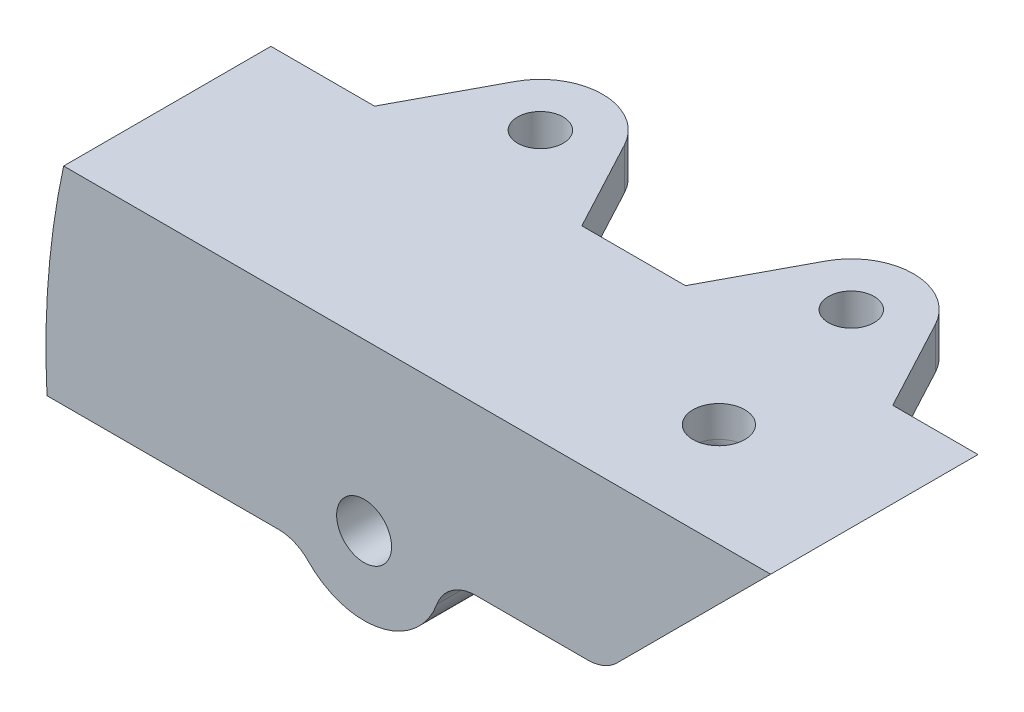
from build123d import *

# Parameters (mm, degrees)
SKETCH2_R           = 2.65
BOSS_EXTRUDE1_DEPTH = 10
SKETCH5_R           = 2.5
CHAMFER1_SIZE       = 3
FILLET4_R           = 4
SKETCH9_R           = 6
SKETCH9_R_2         = 2.2
BOSS_EXTRUDE2_DEPTH = 4
LPATTERN1_COUNT     = 2
LPATTERN1_PITCH     = 30
CHAMFER2_SIZE       = 4


with BuildPart() as part:
    # Sketch2 → Boss-Extrude1 (new, symmetric)
    with BuildSketch(Plane.XY):
        with BuildLine():
            ThreePointArc((-73.989796594, 16), (-75.457580373, 6.053392794), (-75.594245813, -4))
            Line((-75.594245813, -4), (-51.34428877, -4))
            ThreePointArc((-51.34428877, -4), (-42.918193786, -7.205281597), (-37.5, 0))
            Line((-37.5, 0), (-21.763957799, 0))
            Line((-21.763957799, 0), (-5.763957799, 16))
            Line((-5.763957799, 16), (-73.989796594, 16))
        make_face()
        with Locations((-45, 0)):
            Circle(SKETCH2_R, mode=Mode.SUBTRACT)
    extrude(amount=BOSS_EXTRUDE1_DEPTH, both=True)

    # Sketch3 → Cut-Revolve1 (revolve, cut)
    with BuildSketch(Plane.XY, mode=Mode.PRIVATE) as cut_revolve1_sk:
        Polygon((-76.457580373, 8), (-75.457580373, 8), (-50.457580373, 8), (-50.457580373, 12.2), (-70.457580373, 12.2), (-76.457580373, 12.2), align=None)
        Polygon((-76.457580373, 15.2), (-76.457580373, 12.2), (-70.457580373, 12.2), align=None)
    revolve(cut_revolve1_sk.sketch.rotate(Axis((-75.457580373, 8, 0), (1, 0, 0)), 90), axis=Axis((-75.457580373, 8, 0), (1, 0, 0)), mode=Mode.SUBTRACT)

    # Cut-Sweep2: sweep along a path in Sketch7
    with BuildLine(Plane.XY) as cut_sweep2_path:
        Line((-50.457580373, 8), (-25.763957799, 8))
        ThreePointArc((-25.763957799, 8), (-22.228423893, 9.464466094), (-20.763957799, 13))
        Line((-20.763957799, 13), (-20.763957799, 16))
    # Sketch5 → Cut-Sweep2 (sweep, cut)
    with BuildSketch(Plane(origin=(0, 16, 0), x_dir=(1, 0, 0), z_dir=(0, 1, 0))):
        with Locations((-20.763957799, 0)):
            Circle(SKETCH5_R)
    sweep(path=cut_sweep2_path.line, mode=Mode.SUBTRACT)

    # Chamfer1
    # the kernel refuses this chamfer: 3 mm, written as the material it takes off along each edge
    with BuildSketch(Plane(origin=(-50.457580373, 8, 0), x_dir=(0, -1, 0), z_dir=(0, 0, 1))) as chamfer1_piece_1_section:
        Polygon((2.5 + CHAMFER1_SIZE, 0), (2.5, CHAMFER1_SIZE), (2.5, 0), align=None)
    chamfer1_piece_1 = revolve(axis=Axis((-50.457580373, 8, 0), (1, 0, 0)), mode=Mode.PRIVATE)
    chamfer1_piece_1 = chamfer1_piece_1 & Plane(origin=(-48.295596493, 8, 0), x_dir=(0, 0, 1), z_dir=(-1, 0, 0)) * Cylinder(4.2, 22, mode=Mode.PRIVATE)
    add(chamfer1_piece_1, mode=Mode.SUBTRACT)

    # Fillet4
    fillet4_edges = [part.edges().sort_by_distance(p)[0] for p in [
        (-21.763957799, 0, 0),
        (-37.5, 0, 0),
        (-51.34428877, -4, 0),
    ]]
    fillet(fillet4_edges, radius=FILLET4_R)

    # Sketch9 → Boss-Extrude2 (add)
    # profile 1 of 3: a face of its own
    with BuildSketch(Plane(origin=(0, 16, 0), x_dir=(1, 0, 0), z_dir=(0, 1, 0))):
        with Locations((-53.989796594, 16)):
            Circle(SKETCH9_R)
        with Locations(Location((-53.989796594, 16, 0), (0, 0, 270))):
            Circle(SKETCH9_R_2, mode=Mode.SUBTRACT)
    # profile 2 of 3: a face of its own
    with BuildSketch(Plane(origin=(0, 16, 0), x_dir=(1, 0, 0), z_dir=(0, 1, 0))):
        with BuildLine():
            ThreePointArc((-47.989796594, 16), (-49.747155907, 11.757359313), (-53.989796594, 10))
            Line((-53.989796594, 10), (-43.989796594, 10))
            Line((-43.989796594, 10), (-48.695678947, 18.823529412))
            ThreePointArc((-48.695678947, 18.823529412), (-48.168941593, 17.45521375), (-47.989796594, 16))
        make_face()
    # profile 3 of 3: a face of its own
    with BuildSketch(Plane(origin=(0, 16, 0), x_dir=(1, 0, 0), z_dir=(0, 1, 0))):
        with BuildLine():
            Line((-59.283914241, 18.823529412), (-63.989796594, 10))
            Line((-63.989796594, 10), (-53.989796594, 10))
            ThreePointArc((-53.989796594, 10), (-59.134754148, 12.913025467), (-59.283914241, 18.823529412))
        make_face()
    boss_extrude2 = extrude(amount=-BOSS_EXTRUDE2_DEPTH)

    # LPattern1: Boss-Extrude2 ×2
    with Locations(*[(i * LPATTERN1_PITCH, 0, 0) for i in range(1, LPATTERN1_COUNT)]):
        add(boss_extrude2)

    # Chamfer2
    # the kernel refuses this chamfer: 4 mm, written as the material it adds along each edge
    with BuildSketch(Plane(origin=(-33.703064642, 12, -10), x_dir=(0, -0.9996219169112968, 0.027495876610586494), z_dir=(-1, 0, 0))) as chamfer2_piece_1_section:
        Polygon((CHAMFER2_SIZE * 0.999621916911, -CHAMFER2_SIZE * 0.0274958766106), (-CHAMFER2_SIZE * 0.0274958766106, -CHAMFER2_SIZE * 0.999621916911), (0, 0), align=None)
    chamfer2_piece_1 = extrude(amount=40.573463904, mode=Mode.PRIVATE)
    chamfer2_piece_1 = split(chamfer2_piece_1, bisect_by=Plane(origin=(-33.908180605, 9.955648468, -10.153029979), z_dir=(0.882352941176471, 0, 0.4705882352941171)), keep=Keep.TOP, mode=Mode.PRIVATE)
    add(chamfer2_piece_1)
    with BuildSketch(Plane(origin=(-33.703064642, 12, -10), x_dir=(0, -0.9996219169112968, 0.027495876610586494), z_dir=(-1, 0, 0))) as chamfer2_piece_2_section:
        Polygon((CHAMFER2_SIZE * 0.999621916911, -CHAMFER2_SIZE * 0.0274958766106), (-CHAMFER2_SIZE * 0.0274958766106, -CHAMFER2_SIZE * 0.999621916911), (0, 0), align=None)
    chamfer2_piece_2 = extrude(amount=40.573463904, mode=Mode.PRIVATE)
    chamfer2_piece_2 = split(chamfer2_piece_2, bisect_by=Plane(origin=(-61.252355545, 10.648848957, -15.132701966), z_dir=(0.882352941176471, 0, 0.4705882352941171)), keep=Keep.TOP, mode=Mode.PRIVATE)
    chamfer2_piece_2 = split(chamfer2_piece_2, bisect_by=Plane(origin=(-46.727237643, 10.648848957, -15.132701966), z_dir=(-0.8823529411764707, 0, 0.4705882352941174)), keep=Keep.TOP, mode=Mode.PRIVATE)
    chamfer2_piece_2 = chamfer2_piece_2 - Plane(origin=(-53.989796594, 10.648848957, -16), x_dir=(0, 0, 1), z_dir=(0, 1, 0)) * Cylinder(2.2, 98, mode=Mode.PRIVATE)
    add(chamfer2_piece_2)
    with BuildSketch(Plane(origin=(-3.703064642, 12, -10), x_dir=(0, -0.9996219169112968, 0.027495876610586494), z_dir=(-1, 0, 0))) as chamfer2_piece_3_section:
        Polygon((CHAMFER2_SIZE * 0.999621916911, -CHAMFER2_SIZE * 0.0274958766106), (-CHAMFER2_SIZE * 0.0274958766106, -CHAMFER2_SIZE * 0.999621916911), (0, 0), align=None)
    chamfer2_piece_3 = extrude(amount=40.573463904, mode=Mode.PRIVATE)
    chamfer2_piece_3 = split(chamfer2_piece_3, bisect_by=Plane(origin=(-31.252355545, 10.648848957, -15.132701966), z_dir=(0.882352941176471, 0, 0.4705882352941171)), keep=Keep.TOP, mode=Mode.PRIVATE)
    chamfer2_piece_3 = split(chamfer2_piece_3, bisect_by=Plane(origin=(-16.727237643, 10.648848957, -15.132701966), z_dir=(-0.8823529411764707, 0, 0.4705882352941174)), keep=Keep.TOP, mode=Mode.PRIVATE)
    chamfer2_piece_3 = chamfer2_piece_3 - Plane(origin=(-23.989796594, 10.648848957, -16), x_dir=(0, 0, 1), z_dir=(0, 1, 0)) * Cylinder(2.2, 98, mode=Mode.PRIVATE)
    add(chamfer2_piece_3)
    with BuildSketch(Plane(origin=(-3.703064642, 12, -10), x_dir=(0, -0.9996219169112968, 0.027495876610586494), z_dir=(-1, 0, 0))) as chamfer2_piece_4_section:
        Polygon((CHAMFER2_SIZE * 0.999621916911, -CHAMFER2_SIZE * 0.0274958766106), (-CHAMFER2_SIZE * 0.0274958766106, -CHAMFER2_SIZE * 0.999621916911), (0, 0), align=None)
    chamfer2_piece_4 = extrude(amount=40.573463904, mode=Mode.PRIVATE)
    chamfer2_piece_4 = split(chamfer2_piece_4, bisect_by=Plane(origin=(-44.071412583, 9.955648468, -10.153029979), z_dir=(-0.8823529411764707, 0, 0.4705882352941174)), keep=Keep.TOP, mode=Mode.PRIVATE)
    add(chamfer2_piece_4)


solid = part.part
